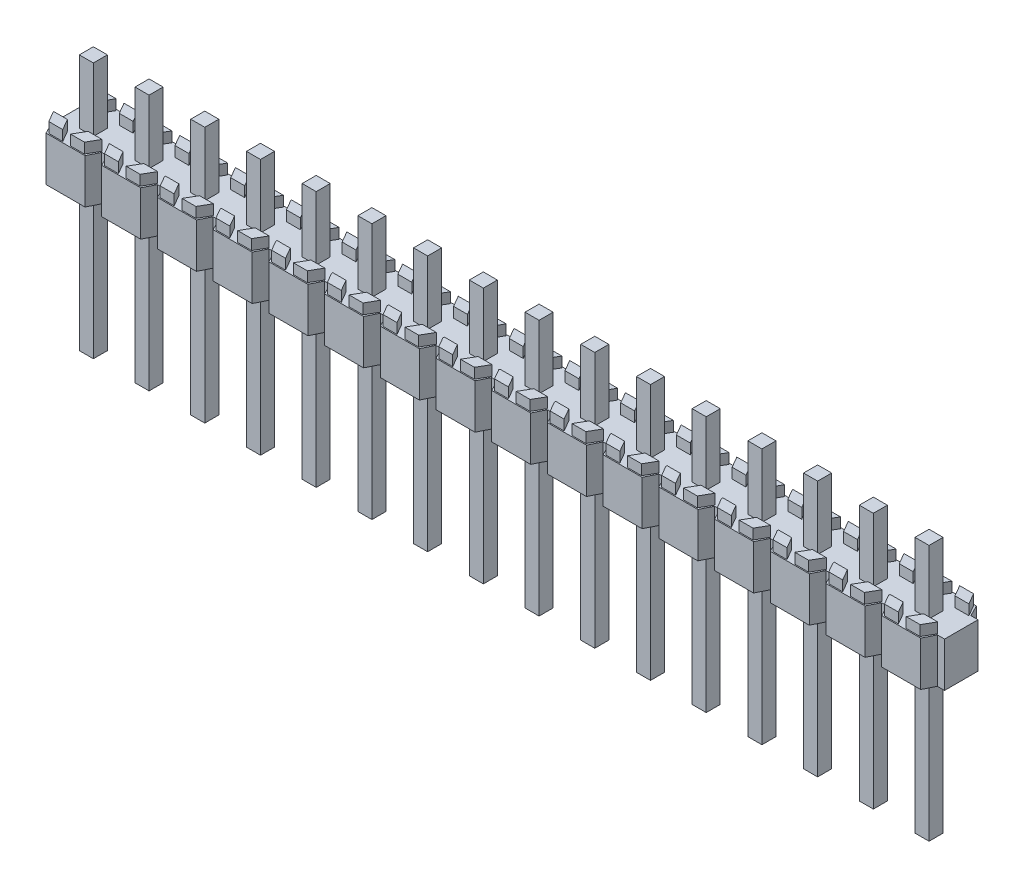
from build123d import *

# Parameters (mm, degrees)
BOSS_EXTRUDE1_START = -1.02
SKETCH1_W           = 0.64
SKETCH1_H           = 0.64
BOSS_EXTRUDE1_DEPTH = 2.5
CUT_EXTRUDE2_DEPTH  = 0.47
SKETCH3_W           = 0.64
SKETCH3_H           = 0.64
BOSS_EXTRUDE2_DEPTH = 2.9
SKETCH4_W           = 0.64
SKETCH4_H           = 0.64
BOSS_EXTRUDE3_DEPTH = 6.75
LPATTERN1_COUNT     = 16
LPATTERN1_PITCH     = 2.54


with BuildPart() as part:
    # Sketch1 → Boss-Extrude1 (new body)
    with BuildSketch(Plane(origin=(0, 0, 0), x_dir=(1, 0, 0), z_dir=(0, 1, 0)).offset(BOSS_EXTRUDE1_START)):
        Polygon((-1.143, 0.762), (-0.889, 1.27), (0.889, 1.27), (1.143, 0.762), (1.47, 0.762), (1.47, -0.762), (1.143, -0.762), (0.889, -1.27), (-0.889, -1.27), (-1.143, -0.762), align=None)
        Rectangle(SKETCH1_W, SKETCH1_H, mode=Mode.SUBTRACT)
    boss_extrude1 = extrude(amount=BOSS_EXTRUDE1_DEPTH)

    # Sketch2 → Cut-Extrude2 (cut)
    with BuildSketch(Plane(origin=(0, 1.48, 0), x_dir=(1, 0, 0), z_dir=(0, 1, 0))):
        Polygon((-1.143, 0.762), (-1.143, -0.762), (-0.889, -1.27), (0.889, -1.27), (1.143, -0.762), (1.47, -0.762), (1.47, 0.762), (1.143, 0.762), (0.889, 1.27), (-0.889, 1.27), align=None)
        Polygon((-1.106093937, -0.7112), (-0.471093937, -0.7112), (-0.1778, -1.2192), (-0.8128, -1.2192), align=None, mode=Mode.SUBTRACT)
        Polygon((-0.8128, 1.2192), (-1.106093937, 0.7112), (-0.471093937, 0.7112), (-0.1778, 1.2192), align=None, mode=Mode.SUBTRACT)
        Polygon((1.106093937, 0.7112), (0.471093937, 0.7112), (0.1778, 1.2192), (0.8128, 1.2192), align=None, mode=Mode.SUBTRACT)
        Polygon((0.8128, -1.2192), (1.106093937, -0.7112), (0.471093937, -0.7112), (0.1778, -1.2192), align=None, mode=Mode.SUBTRACT)
    cut_extrude2 = extrude(amount=-CUT_EXTRUDE2_DEPTH, mode=Mode.SUBTRACT)


with BuildPart() as body_2:
    # Sketch3 → Boss-Extrude2 (new body)
    with BuildSketch(Plane(origin=(0, 1.01, 0), x_dir=(1, 0, 0), z_dir=(0, 1, 0))):
        Rectangle(SKETCH3_W, SKETCH3_H)
    boss_extrude2 = extrude(amount=BOSS_EXTRUDE2_DEPTH)


with BuildPart() as body_3:
    # Sketch4 → Boss-Extrude3 (new body)
    with BuildSketch(Plane.XZ.offset(1.02)):
        Rectangle(SKETCH4_W, SKETCH4_H)
    boss_extrude3 = extrude(amount=BOSS_EXTRUDE3_DEPTH)


with BuildPart() as part_1:
    add(part.part)

    # LPattern1: Boss-Extrude1, Cut-Extrude2, Boss-Extrude2, Boss-Extrude3 ×16
    with Locations(*[(i * LPATTERN1_PITCH, 0, 0) for i in range(1, LPATTERN1_COUNT)]):
        add(boss_extrude1)
        add(cut_extrude2, mode=Mode.SUBTRACT)
        add(boss_extrude2)
        add(boss_extrude3)


solid = Compound([body_2.part, body_3.part, part_1.part])
